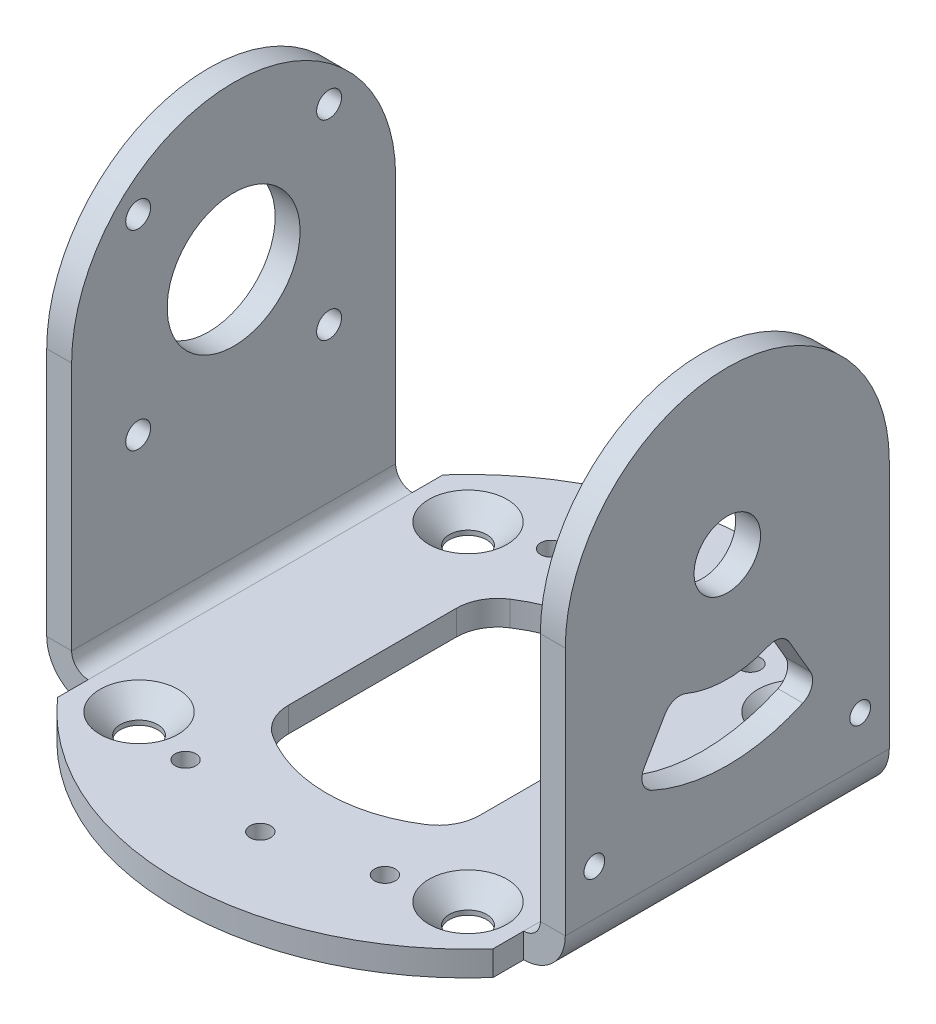
from build123d import *

# Parameters (mm, degrees)
BASE_FLANGE1_DEPTH                           = 19.5
SKETCH13_R                                   = 4
CUT_EXTRUDE6_DEPTH                           = 84.228219974
CUT_EXTRUDE7_DEPTH                           = 84.228219974
CUT_EXTRUDE7_DEPTH_BACK                      = 84.228219974
SKETCH33_R                                   = 8
CUT_EXTRUDE10_DEPTH                          = 10
SKETCH34_R                                   = 1.5
CUT_EXTRUDE11_DEPTH                          = 10
BOSS_EXTRUDE1_DEPTH                          = 3
TAB1_START                                   = -3
TAB1_DEPTH                                   = 3
CSK_FOR_M4_COUNTERSUNK_FLAT_HEAD_SCR_2_COUNT = 2
CSK_FOR_M4_COUNTERSUNK_FLAT_HEAD_SCR_2_PITCH = 39.597979746
CSK_FOR_M4_COUNTERSUNK_FLAT_HEAD_SCR_3_COUNT = 2
CSK_FOR_M4_COUNTERSUNK_FLAT_HEAD_SCR_3_PITCH = 56
CSK_FOR_M4_COUNTERSUNK_FLAT_HEAD_SCR_4_COUNT = 2
CSK_FOR_M4_COUNTERSUNK_FLAT_HEAD_SCR_4_PITCH = 39.597979746
SKETCH44_R                                   = 1.25
CUT_EXTRUDE13_DEPTH                          = 10
SKETCH45_R                                   = 1.25
CUT_EXTRUDE14_DEPTH                          = 10


# Read off the part's stored shape, not the designer's step: Tab1
# Sheet-metal steps are written as plain solids
with BuildPart() as part:
    # Sketch1 → Base-Flange1 (new, symmetric)
    with BuildSketch(Plane.XY):
        with BuildLine():
            Line((-28.21, 74.65), (-28.21, 2))
            ThreePointArc((-28.21, 2), (-27.624213562, 0.585786438), (-26.21, 0))
            Line((-26.21, 0), (26.21, 0))
            ThreePointArc((26.21, 0), (27.624213562, 0.585786438), (28.21, 2))
            Line((28.21, 2), (28.21, 74.65))
            Line((28.21, 74.65), (31.21, 74.65))
            Line((31.21, 74.65), (31.21, 2))
            ThreePointArc((31.21, 2), (29.745533906, -1.535533906), (26.21, -3))
            Line((26.21, -3), (-26.21, -3))
            ThreePointArc((-26.21, -3), (-29.745533906, -1.535533906), (-31.21, 2))
            Line((-31.21, 2), (-31.21, 74.65))
            Line((-31.21, 74.65), (-28.21, 74.65))
        make_face()
    extrude(amount=BASE_FLANGE1_DEPTH, both=True)

    # Sketch13 → Cut-Extrude6 (cut, through all)
    with BuildSketch(Plane(origin=(0, 0, 0), x_dir=(0, 0, -1), z_dir=(1, 0, 0))):
        with Locations((0, 32)):
            Circle(SKETCH13_R)
    extrude(amount=CUT_EXTRUDE6_DEPTH, mode=Mode.SUBTRACT)

    # Sketch15 → Cut-Extrude7 (cut, two sides: drawn at the far end of the back side and taken through both)
    with BuildSketch(Plane(origin=(0, 0, 0), x_dir=(0, 0, -1), z_dir=(1, 0, 0)).offset(-CUT_EXTRUDE7_DEPTH_BACK)):
        with BuildLine():
            Line((-19.5, 32), (-26.744382408, 32))
            Line((-26.744382408, 32), (-26.744382408, 87.632847334))
            Line((-26.744382408, 87.632847334), (26.744382408, 87.632847334))
            Line((26.744382408, 87.632847334), (26.744382408, 32))
            Line((26.744382408, 32), (19.5, 32))
            ThreePointArc((19.5, 32), (0, 51.5), (-19.5, 32))
        make_face()
        with BuildLine():
            Line((7.470480628, 19.147299148), (10, 14.795349466))
            ThreePointArc((10, 14.795349466), (10.176160856, 13.182152576), (9.097954318, 11.969342816))
            ThreePointArc((9.097954318, 11.969342816), (0, 10), (-9.097954318, 11.969342816))
            ThreePointArc((-9.097954318, 11.969342816), (-10.176160856, 13.182152576), (-10, 14.795349466))
            Line((-10, 14.795349466), (-7.470480628, 19.147299148))
            ThreePointArc((-7.470480628, 19.147299148), (-6.381394917, 20.037080634), (-4.975835097, 19.989959822))
            ThreePointArc((-4.975835097, 19.989959822), (0, 19), (4.975835097, 19.989959822))
            ThreePointArc((4.975835097, 19.989959822), (6.381394917, 20.037080634), (7.470480628, 19.147299148))
        make_face()
    extrude(amount=CUT_EXTRUDE7_DEPTH + CUT_EXTRUDE7_DEPTH_BACK, mode=Mode.SUBTRACT)

    # Sketch33 → Cut-Extrude10 (cut)
    with BuildSketch(Plane(origin=(-28.21, 0, 0), x_dir=(0, 0, -1), z_dir=(1, 0, 0))):
        with Locations((0, 32)):
            Circle(SKETCH33_R)
    extrude(amount=-CUT_EXTRUDE10_DEPTH, mode=Mode.SUBTRACT)

    # Sketch34 → Cut-Extrude11 (cut)
    with BuildSketch(Plane.ZY.offset(31.21)):
        with Locations((-11.490485194, 43.490485194)):
            Circle(SKETCH34_R)
        with Locations((11.490485194, 43.490485194)):
            Circle(SKETCH34_R)
        with Locations((11.490485194, 20.509514806)):
            Circle(SKETCH34_R)
        with Locations((-11.490485194, 20.509514806)):
            Circle(SKETCH34_R)
    extrude(amount=-CUT_EXTRUDE11_DEPTH, mode=Mode.SUBTRACT)

    # Sketch37 → Boss-Extrude1 (add)
    with BuildSketch(Plane.ZY.offset(31.21)):
        with BuildLine():
            Line((7.470480628, 19.147299148), (10, 14.795349466))
            ThreePointArc((10, 14.795349466), (10.176160856, 13.182152576), (9.097954318, 11.969342816))
            ThreePointArc((9.097954318, 11.969342816), (0, 10), (-9.097954318, 11.969342816))
            ThreePointArc((-9.097954318, 11.969342816), (-10.176160856, 13.182152576), (-10, 14.795349466))
            Line((-10, 14.795349466), (-7.470480628, 19.147299148))
            ThreePointArc((-7.470480628, 19.147299148), (-6.381394917, 20.037080634), (-4.975835097, 19.989959822))
            ThreePointArc((-4.975835097, 19.989959822), (0, 19), (4.975835097, 19.989959822))
            ThreePointArc((4.975835097, 19.989959822), (6.381394917, 20.037080634), (7.470480628, 19.147299148))
        make_face()
    extrude(amount=-BOSS_EXTRUDE1_DEPTH)

    # Tab1 outline → Tab1 (add)
    with BuildSketch(Plane.XZ.offset(3).offset(TAB1_START)):
        with BuildLine():
            Line((26.21, 19.5), (26.21, 23.195600876))
            ThreePointArc((26.21, 23.195600876), (0, 35), (-26.21, 23.195600876))
            Line((-26.21, 23.195600876), (-26.21, 19.5))
            Line((-26.21, 19.5), (26.21, 19.5))
        make_face()
        with BuildLine():
            Line((-26.21, -19.5), (-26.21, -23.195600876))
            ThreePointArc((-26.21, -23.195600876), (0, -35), (26.21, -23.195600876))
            Line((26.21, -23.195600876), (26.21, -19.5))
            Line((26.21, -19.5), (-26.21, -19.5))
        make_face()
    extrude(amount=TAB1_DEPTH)

    # Sketch42 → CSK for M4 Countersunk Flat Head Screw1 (revolve, cut)
    with BuildSketch(Plane(origin=(19.798989873, 0, -19.798989873), x_dir=(0, 0, 1), z_dir=(1, 0, 0))):
        Polygon((0, 0), (0, 3), (2.25, 3), (2.25, 2.45), (4.7, 0), align=None)
    csk_for_m4_countersunk_flat_head_screw1 = revolve(axis=Axis((19.798989873, 6.35, -19.798989873), (0, -1, 0)), mode=Mode.SUBTRACT)

    # CSK for M4 Countersunk Flat Head Scr 2: CSK for M4 Countersunk Flat Head Screw1 ×2
    with Locations(*[(-i * CSK_FOR_M4_COUNTERSUNK_FLAT_HEAD_SCR_2_PITCH, 0, 0) for i in range(1, CSK_FOR_M4_COUNTERSUNK_FLAT_HEAD_SCR_2_COUNT)]):
        add(csk_for_m4_countersunk_flat_head_screw1, mode=Mode.SUBTRACT)

    # CSK for M4 Countersunk Flat Head Scr 3: CSK for M4 Countersunk Flat Head Screw1 ×2
    with Locations(*[Vector(-0.7071067811865476, 0, 0.7071067811865476) * (i * CSK_FOR_M4_COUNTERSUNK_FLAT_HEAD_SCR_3_PITCH) for i in range(1, CSK_FOR_M4_COUNTERSUNK_FLAT_HEAD_SCR_3_COUNT)]):
        add(csk_for_m4_countersunk_flat_head_screw1, mode=Mode.SUBTRACT)

    # CSK for M4 Countersunk Flat Head Scr 4: CSK for M4 Countersunk Flat Head Screw1 ×2
    with Locations(*[(0, 0, i * CSK_FOR_M4_COUNTERSUNK_FLAT_HEAD_SCR_4_PITCH) for i in range(1, CSK_FOR_M4_COUNTERSUNK_FLAT_HEAD_SCR_4_COUNT)]):
        add(csk_for_m4_countersunk_flat_head_screw1, mode=Mode.SUBTRACT)

    # Sketch44 → Cut-Extrude13 (cut)
    with BuildSketch(Plane(origin=(0, 0, 0), x_dir=(1, 0, 0), z_dir=(0, 1, 0))):
        with Locations(Location((0, 25, 0), (0, 0, 270))):
            Circle(SKETCH44_R)
        with Locations(Location((12, 22, 0), (0, 0, 270))):
            Circle(SKETCH44_R)
        with Locations(Location((-12, 22, 0), (0, 0, 90))):
            Circle(SKETCH44_R)
        with Locations(Location((12, -22, 0), (0, 0, 90))):
            Circle(SKETCH44_R)
        with Locations(Location((0, -25, 0), (0, 0, 90))):
            Circle(SKETCH44_R)
        with Locations(Location((-12, -22, 0), (0, 0, 270))):
            Circle(SKETCH44_R)
        with BuildLine():
            Line((-11.5, 10.087120501), (-11.5, -10.087120501))
            ThreePointArc((-11.5, -10.087120501), (-10.88985573, -12.48068827), (-9.208333333, -14.290087376))
            ThreePointArc((-9.208333333, -14.290087376), (0, -17), (9.208333333, -14.290087376))
            ThreePointArc((9.208333333, -14.290087376), (10.88985573, -12.48068827), (11.5, -10.087120501))
            Line((11.5, -10.087120501), (11.5, 10.087120501))
            ThreePointArc((11.5, 10.087120501), (10.88985573, 12.48068827), (9.208333333, 14.290087376))
            ThreePointArc((9.208333333, 14.290087376), (0, 17), (-9.208333333, 14.290087376))
            ThreePointArc((-9.208333333, 14.290087376), (-10.88985573, 12.48068827), (-11.5, 10.087120501))
        make_face()
    extrude(amount=-CUT_EXTRUDE13_DEPTH, mode=Mode.SUBTRACT)

    # Sketch45 → Cut-Extrude14 (cut)
    with BuildSketch(Plane(origin=(31.21, 0, 0), x_dir=(0, 0, -1), z_dir=(1, 0, 0))):
        with Locations((-16, 7.5)):
            Circle(SKETCH45_R)
        with Locations((16, 7.5)):
            Circle(SKETCH45_R)
    extrude(amount=-CUT_EXTRUDE14_DEPTH, mode=Mode.SUBTRACT)


solid = part.part
